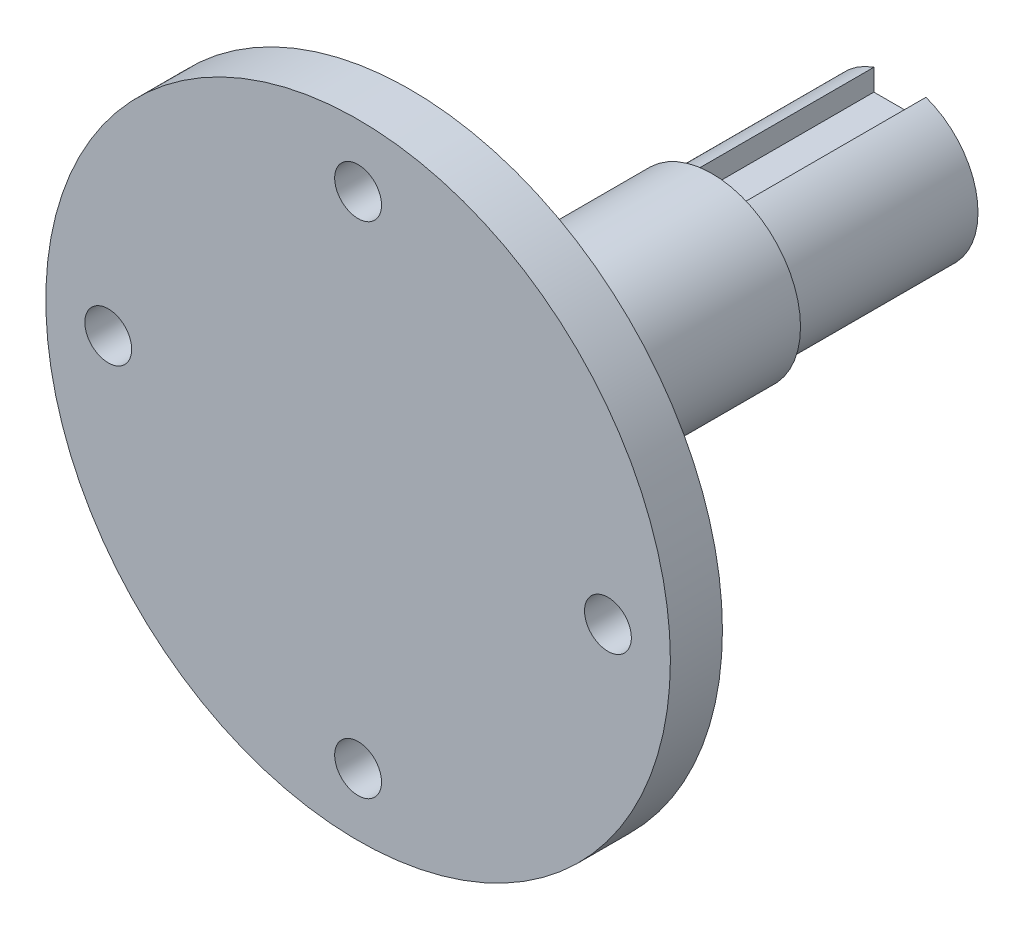
from build123d import *

# Parameters (mm, degrees)
SKETCH1_R                 = 7.5
BOSS_EXTRUDE1_DEPTH       = 20.05
SKETCH3_W                 = 5
SKETCH3_H                 = 5
CUT_EXTRUDE1_DEPTH        = 21
SKETCH6_R                 = 8.5
BOSS_EXTRUDE2_DEPTH       = 24
SKETCH7_R                 = 11.25
BOSS_EXTRUDE3_DEPTH       = 5
SKETCH8_R                 = 30
BOSS_EXTRUDE4_DEPTH       = 5
FILLET1_R                 = 0.6
FILLET2_R                 = 5
M4_CLEARANCE_HOLE1_D      = 4.5
F_1_0MM_DOWEL_HOLE1_D     = 8.255
F_1_0MM_DOWEL_HOLE1_DEPTH = 8
SKETCH13_R                = 7.5
CUT_EXTRUDE2_DEPTH        = 2
M6_CLEARANCE_HOLE1_D      = 6.6
M6_CLEARANCE_HOLE1_DEPTH  = 12


with BuildPart() as part:
    # Sketch1 → Boss-Extrude1 (new body)
    with BuildSketch(Plane.XY):
        Circle(SKETCH1_R)
    extrude(amount=BOSS_EXTRUDE1_DEPTH)

    # Sketch3 → Cut-Extrude1 (cut)
    with BuildSketch(Plane(origin=(0, 0, 0), x_dir=(-1, 0, 0), z_dir=(0, 0, -1))):
        with Locations((0, 7.5)):
            Rectangle(SKETCH3_W, SKETCH3_H)
    extrude(amount=-CUT_EXTRUDE1_DEPTH, mode=Mode.SUBTRACT)

    # Sketch6 → Boss-Extrude2 (add)
    with BuildSketch(Plane.XY.offset(20.05)):
        Circle(SKETCH6_R)
    extrude(amount=BOSS_EXTRUDE2_DEPTH)

    # Sketch7 → Boss-Extrude3 (add)
    with BuildSketch(Plane.XY.offset(44.05)):
        Circle(SKETCH7_R)
    extrude(amount=BOSS_EXTRUDE3_DEPTH)

    # Sketch8 → Boss-Extrude4 (add)
    with BuildSketch(Plane.XY.offset(49.05)):
        Circle(SKETCH8_R)
    extrude(amount=BOSS_EXTRUDE4_DEPTH)

    # Fillet1
    fillet1_edges = [part.edges().sort_by_distance(p)[0] for p in [
        (-8.5, 0, 44.05),
    ]]
    fillet(fillet1_edges, radius=FILLET1_R)

    # Fillet2
    fillet2_edges = [part.edges().sort_by_distance(p)[0] for p in [
        (-11.25, 0, 49.05),
    ]]
    fillet(fillet2_edges, radius=FILLET2_R - 0.0001)  # a hair under: the kernel refuses the full size

    # M4 Clearance Hole1 (through all)
    with Locations(Plane.XY.offset(54.05)):
        with Locations((0, 24), (0, -24), (24, 0), (-24, 0)):
            Hole(M4_CLEARANCE_HOLE1_D / 2)

    # Ø1.0mm Dowel Hole1
    with Locations(Plane(origin=(0, 0, 0), x_dir=(-1, 0, 0), z_dir=(0, 0, -1))):
        with Locations((0, 0)):
            Hole(F_1_0MM_DOWEL_HOLE1_D / 2, depth=F_1_0MM_DOWEL_HOLE1_DEPTH)

    # Sketch13 → Cut-Extrude2 (cut)
    with BuildSketch(Plane(origin=(0, 0, 0), x_dir=(-1, 0, 0), z_dir=(0, 0, -1))):
        Circle(SKETCH13_R)
    extrude(amount=-CUT_EXTRUDE2_DEPTH, mode=Mode.SUBTRACT)

    # M6 Clearance Hole1
    with Locations(Plane(origin=(0, 0, 8), x_dir=(-1, 0, 0), z_dir=(0, 0, -1))):
        with Locations((0, 0)):
            Hole(M6_CLEARANCE_HOLE1_D / 2, depth=M6_CLEARANCE_HOLE1_DEPTH)


solid = part.part
